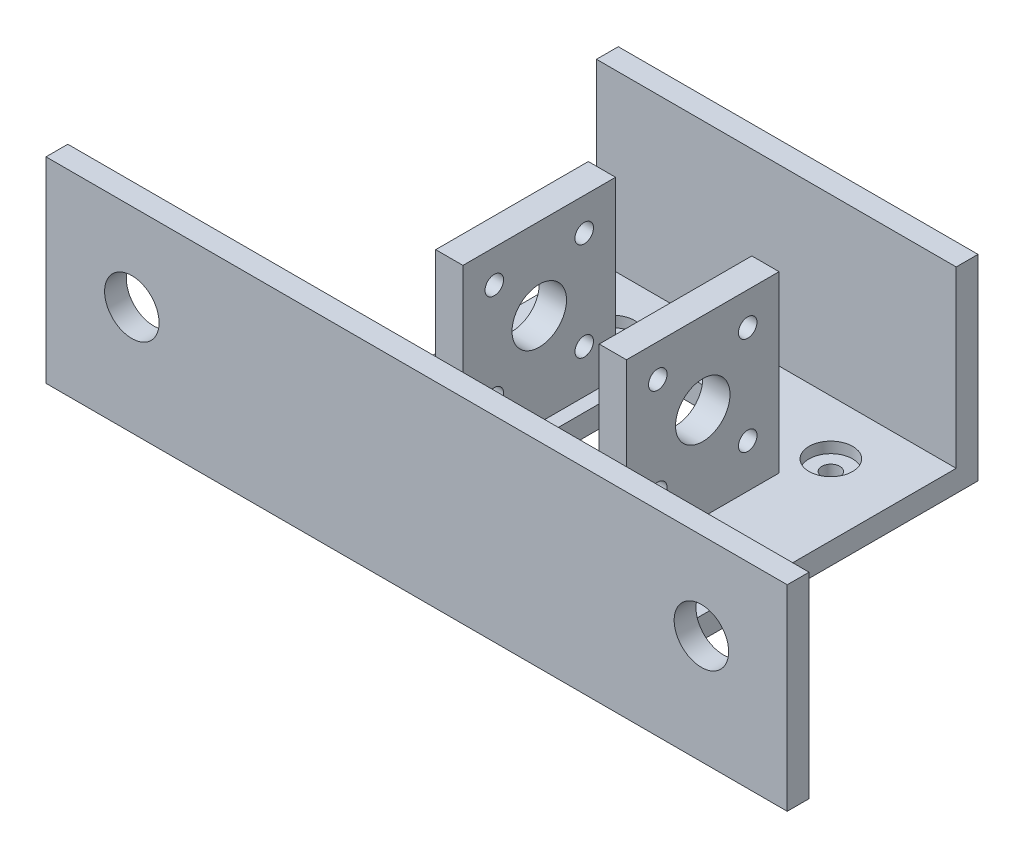
from build123d import *

# Parameters (mm, degrees)
SKETCH1_W                 = 75
SKETCH1_H                 = 40
SKETCH1_R                 = 5
SKETCH1_R_2               = 1.7
SKETCH1_W_2               = 10
SKETCH1_H_2               = 20
BOSS_EXTRUDE1_DEPTH       = 3
CUT_EXTRUDE1_DEPTH        = 43.605750786
CUT_EXTRUDE1_DEPTH_BACK   = 43.605750786
SKETCH2_W                 = 67
SKETCH2_H                 = 28
BOSS_EXTRUDE3_DEPTH       = 110
BOSS_EXTRUDE3_DEPTH_BACK  = 3
SKETCH3_W                 = 75
SKETCH3_H                 = 70
SKETCH3_W_2               = 67
SKETCH3_H_2               = 40
SKETCH6_W                 = 67
SKETCH6_H                 = 11
CUT_EXTRUDE4_DEPTH        = 122.372360939
SKETCH7_W                 = 70
SKETCH7_H                 = 37
BOSS_EXTRUDE4_DEPTH       = 45
SKETCH8_W                 = 45
SKETCH8_H                 = 62
CUT_EXTRUDE6_DEPTH        = 29
SKETCH11_W                = 45
SKETCH11_H                = 4
CUT_EXTRUDE9_DEPTH        = 157.445677473
SKETCH9_W                 = 38
SKETCH9_H                 = 28.5
CUT_EXTRUDE10_DEPTH       = 204.024629048
SKETCH13_W                = 5
SKETCH13_H                = 38
BOSS_EXTRUDE5_DEPTH       = 32
SKETCH14_R                = 5
SKETCH14_R_2              = 1.7
CUT_EXTRUDE11_DEPTH       = 32
SKETCH15_W                = 165
SKETCH15_H                = 70
SKETCH15_W_2              = 157
SKETCH15_H_2              = 62
BOSS_EXTRUDE6_DEPTH       = 3
SKETCH16_W                = 20
SKETCH16_H                = 4.820648258
CUT_EXTRUDE12_DEPTH       = 159.626132778
SKETCH18_R                = 5
CUT_EXTRUDE14_DEPTH       = 159.626132778
MIRROR6_COPY_1_SKETCH_W   = 5
MIRROR6_COPY_1_SKETCH_H   = 38
MIRROR6_COPY_1_DEPTH      = 32
MIRROR6_COPY_2_SKETCH_R   = 5
MIRROR6_COPY_2_SKETCH_R_2 = 1.7
MIRROR6_COPY_2_DEPTH      = 32
MIRROR6_COPY_3_SKETCH_W   = 5
MIRROR6_COPY_3_SKETCH_H   = 38
MIRROR6_COPY_3_DEPTH      = 32
MIRROR6_COPY_4_SKETCH_R   = 5
MIRROR6_COPY_4_SKETCH_R_2 = 1.7
MIRROR6_COPY_4_DEPTH      = 32
SKETCH19_W                = 38
SKETCH19_H                = 3.5
CUT_EXTRUDE15_DEPTH       = 10
SKETCH20_R                = 1.2
CUT_EXTRUDE16_DEPTH       = 10
SKETCH21_W                = 10
SKETCH21_H                = 80
CUT_EXTRUDE17_DEPTH       = 184.330984833
SKETCH22_W                = 55
SKETCH22_H                = 80
CUT_EXTRUDE18_DEPTH       = 184.330984833
SKETCH23_W                = 67
SKETCH23_H                = 62
BOSS_EXTRUDE7_DEPTH       = 4
SKETCH24_R                = 10
SKETCH24_R_2              = 1.65
CUT_EXTRUDE19_DEPTH       = 111.123793978
CUT_EXTRUDE21_START       = -16
SKETCH25_R                = 5
CUT_EXTRUDE21_DEPTH       = 16
SKETCH26_W                = 14.5
SKETCH26_H                = 36
CUT_EXTRUDE22_DEPTH       = 178.837706913
SKETCH27_W                = 5
SKETCH27_H                = 64
CUT_EXTRUDE23_DEPTH       = 43
CUT_EXTRUDE24_DEPTH       = 100.724620832
SKETCH29_R                = 4
SKETCH29_R_2              = 1.65
CUT_EXTRUDE25_DEPTH       = 2
SKETCH30_W                = 5
SKETCH30_H                = 28
BOSS_EXTRUDE8_DEPTH       = 32
CUT_EXTRUDE26_START       = -32
SKETCH32_R                = 5
SKETCH32_R_2              = 1.7
CUT_EXTRUDE26_DEPTH       = 32
CUT_EXTRUDE27_DEPTH       = 32


with BuildPart() as part:
    # Sketch1 → Boss-Extrude1 (new body)
    with BuildSketch(Plane(origin=(0, 0, 0), x_dir=(1, 0, 0), z_dir=(0, 1, 0))):
        Rectangle(SKETCH1_W, SKETCH1_H)
        with Locations((-21, 0)):
            Circle(SKETCH1_R, mode=Mode.SUBTRACT)
        with Locations((-30, 8.25)):
            Circle(SKETCH1_R_2, mode=Mode.SUBTRACT)
        with Locations((-12, 8.25)):
            Circle(SKETCH1_R_2, mode=Mode.SUBTRACT)
        with Locations((-12, -8.25)):
            Circle(SKETCH1_R_2, mode=Mode.SUBTRACT)
        with Locations((-30, -8.25)):
            Circle(SKETCH1_R_2, mode=Mode.SUBTRACT)
        with Locations((12, 8.25)):
            Circle(SKETCH1_R_2, mode=Mode.SUBTRACT)
        with Locations((12, -8.25)):
            Circle(SKETCH1_R_2, mode=Mode.SUBTRACT)
        with Locations((21, 0)):
            Circle(SKETCH1_R, mode=Mode.SUBTRACT)
        with Locations((30, -8.25)):
            Circle(SKETCH1_R_2, mode=Mode.SUBTRACT)
        with Locations((30, 8.25)):
            Circle(SKETCH1_R_2, mode=Mode.SUBTRACT)
        Rectangle(SKETCH1_W_2, SKETCH1_H_2, mode=Mode.SUBTRACT)
    extrude(amount=BOSS_EXTRUDE1_DEPTH)

    # Sketch2 → Cut-Extrude1 (cut, two sides: drawn at the far end of the back side and taken through both)
    with BuildSketch(Plane(origin=(0, 3, 0), x_dir=(1, 0, 0), z_dir=(0, 1, 0)).offset(-CUT_EXTRUDE1_DEPTH_BACK)):
        Rectangle(SKETCH2_W, SKETCH2_H)
    extrude(amount=CUT_EXTRUDE1_DEPTH + CUT_EXTRUDE1_DEPTH_BACK, mode=Mode.SUBTRACT)

    # Sketch3 → Boss-Extrude3 (add, two sides: drawn at the far end of the back side and taken through both)
    with BuildSketch(Plane(origin=(0, 3, 0), x_dir=(1, 0, 0), z_dir=(0, 1, 0)).offset(-BOSS_EXTRUDE3_DEPTH_BACK)):
        Rectangle(SKETCH3_W, SKETCH3_H)
        Rectangle(SKETCH3_W_2, SKETCH3_H_2, mode=Mode.SUBTRACT)
    extrude(amount=BOSS_EXTRUDE3_DEPTH + BOSS_EXTRUDE3_DEPTH_BACK)

    # Sketch6 → Cut-Extrude4 (cut, through all)
    with BuildSketch(Plane(origin=(0, 3, 0), x_dir=(1, 0, 0), z_dir=(0, 1, 0))):
        with Locations((0, -25.5)):
            Rectangle(SKETCH6_W, SKETCH6_H)
        with Locations((0, 25.5)):
            Rectangle(SKETCH6_W, SKETCH6_H)
    extrude(amount=CUT_EXTRUDE4_DEPTH, mode=Mode.SUBTRACT)

    # Sketch7 → Boss-Extrude4 (add)
    with BuildSketch(Plane.ZY.offset(37.5)):
        with Locations((0, 94.5)):
            Rectangle(SKETCH7_W, SKETCH7_H)
    boss_extrude4 = extrude(amount=BOSS_EXTRUDE4_DEPTH)

    # Mirror2: Boss-Extrude4 across plane
    add(boss_extrude4.mirror(Plane(origin=(0, 0, 0), x_dir=(0, 0, 1), z_dir=(1, 0, 0))))

    # Sketch8 → Cut-Extrude6 (cut)
    with BuildSketch(Plane(origin=(0, 113, 0), x_dir=(1, 0, 0), z_dir=(0, 1, 0))):
        with Locations((-56, 0)):
            Rectangle(SKETCH8_W, SKETCH8_H)
        with Locations((56, 0)):
            Rectangle(SKETCH8_W, SKETCH8_H)
    extrude(amount=-CUT_EXTRUDE6_DEPTH, mode=Mode.SUBTRACT)

    # Sketch11 → Cut-Extrude9 (cut, through all)
    with BuildSketch(Plane.XY.offset(35)):
        with Locations((-60, 78)):
            Rectangle(SKETCH11_W, SKETCH11_H)
        with Locations((60, 78)):
            Rectangle(SKETCH11_W, SKETCH11_H)
    extrude(amount=-CUT_EXTRUDE9_DEPTH, mode=Mode.SUBTRACT)

    # Sketch9 → Cut-Extrude10 (cut, through all)
    with BuildSketch(Plane.ZY.offset(82.5)):
        with Locations((0, 98.25)):
            Rectangle(SKETCH9_W, SKETCH9_H)
    extrude(amount=-CUT_EXTRUDE10_DEPTH, mode=Mode.SUBTRACT)

    # Sketch13 → Boss-Extrude5 (add)
    with BuildSketch(Plane(origin=(0, 84, 0), x_dir=(1, 0, 0), z_dir=(0, 1, 0))):
        with Locations((-39, 0)):
            Rectangle(SKETCH13_W, SKETCH13_H)
    boss_extrude5 = extrude(amount=BOSS_EXTRUDE5_DEPTH)

    # Sketch14 → Cut-Extrude11 (cut)
    with BuildSketch(Plane.ZY.offset(41.5)):
        with Locations((0, 101)):
            Circle(SKETCH14_R)
        with Locations((-8.25, 110)):
            Circle(SKETCH14_R_2)
        with Locations((8.25, 110)):
            Circle(SKETCH14_R_2)
        with Locations((8.25, 92)):
            Circle(SKETCH14_R_2)
        with Locations((-8.25, 92)):
            Circle(SKETCH14_R_2)
    cut_extrude11 = extrude(amount=-CUT_EXTRUDE11_DEPTH, mode=Mode.SUBTRACT)

    # Mirror4: Boss-Extrude5, Cut-Extrude11 across plane
    add(boss_extrude5.mirror(Plane(origin=(0, 0, 0), x_dir=(0, 0, 1), z_dir=(1, 0, 0))))
    add(cut_extrude11.mirror(Plane(origin=(0, 0, 0), x_dir=(0, 0, 1), z_dir=(1, 0, 0))), mode=Mode.SUBTRACT)

    # Sketch15 → Boss-Extrude6 (add)
    with BuildSketch(Plane(origin=(0, 113, 0), x_dir=(1, 0, 0), z_dir=(0, 1, 0))):
        Rectangle(SKETCH15_W, SKETCH15_H)
        Rectangle(SKETCH15_W_2, SKETCH15_H_2, mode=Mode.SUBTRACT)
    extrude(amount=BOSS_EXTRUDE6_DEPTH)

    # Sketch16 → Cut-Extrude12 (cut, through all)
    with BuildSketch(Plane.XY.offset(35)):
        with Locations((0, 11.636111214)):
            Rectangle(SKETCH16_W, SKETCH16_H)
    extrude(amount=-CUT_EXTRUDE12_DEPTH, mode=Mode.SUBTRACT)

    # Sketch18 → Cut-Extrude14 (cut, through all)
    with BuildSketch(Plane.XY.offset(35)):
        with Locations((52.25, 100)):
            Circle(SKETCH18_R)
    cut_extrude14 = extrude(amount=-CUT_EXTRUDE14_DEPTH, mode=Mode.SUBTRACT)

    # Mirror5: Cut-Extrude14 across plane
    add(cut_extrude14.mirror(Plane(origin=(0, 0, 0), x_dir=(0, 0, 1), z_dir=(1, 0, 0))), mode=Mode.SUBTRACT)

    # Mirror6 copy 1 sketch → Mirror6 copy 1 (add)
    with BuildSketch(Plane(origin=(0, 148, 0), x_dir=(-1, 0, 0), z_dir=(0, -1, 0))):
        with Locations((-39, 0)):
            Rectangle(MIRROR6_COPY_1_SKETCH_W, MIRROR6_COPY_1_SKETCH_H)
    extrude(amount=MIRROR6_COPY_1_DEPTH)

    # Mirror6 copy 2 sketch → Mirror6 copy 2 (cut)
    with BuildSketch(Plane(origin=(41.5, 232, 0), x_dir=(0, 0, 1), z_dir=(1, 0, 0))):
        with Locations((0, 101)):
            Circle(MIRROR6_COPY_2_SKETCH_R)
        with Locations((-8.25, 110)):
            Circle(MIRROR6_COPY_2_SKETCH_R_2)
        with Locations((8.25, 110)):
            Circle(MIRROR6_COPY_2_SKETCH_R_2)
        with Locations((8.25, 92)):
            Circle(MIRROR6_COPY_2_SKETCH_R_2)
        with Locations((-8.25, 92)):
            Circle(MIRROR6_COPY_2_SKETCH_R_2)
    extrude(amount=-MIRROR6_COPY_2_DEPTH, mode=Mode.SUBTRACT)

    # Mirror6 copy 3 sketch → Mirror6 copy 3 (add)
    with BuildSketch(Plane.XZ.offset(-148)):
        with Locations((-39, 0)):
            Rectangle(MIRROR6_COPY_3_SKETCH_W, MIRROR6_COPY_3_SKETCH_H)
    extrude(amount=MIRROR6_COPY_3_DEPTH)

    # Mirror6 copy 4 sketch → Mirror6 copy 4 (cut)
    with BuildSketch(Plane(origin=(-41.5, 232, 0), x_dir=(0, 0, 1), z_dir=(-1, 0, 0))):
        with Locations((0, -101)):
            Circle(MIRROR6_COPY_4_SKETCH_R)
        with Locations((-8.25, -110)):
            Circle(MIRROR6_COPY_4_SKETCH_R_2)
        with Locations((8.25, -110)):
            Circle(MIRROR6_COPY_4_SKETCH_R_2)
        with Locations((8.25, -92)):
            Circle(MIRROR6_COPY_4_SKETCH_R_2)
        with Locations((-8.25, -92)):
            Circle(MIRROR6_COPY_4_SKETCH_R_2)
    extrude(amount=-MIRROR6_COPY_4_DEPTH, mode=Mode.SUBTRACT)

    # Sketch19 → Cut-Extrude15 (cut)
    with BuildSketch(Plane(origin=(82.5, 0, 0), x_dir=(0, 0, -1), z_dir=(1, 0, 0))):
        with Locations((0, 114.25)):
            Rectangle(SKETCH19_W, SKETCH19_H)
    cut_extrude15 = extrude(amount=-CUT_EXTRUDE15_DEPTH, mode=Mode.SUBTRACT)

    # Mirror7: Cut-Extrude15 across plane
    add(cut_extrude15.mirror(Plane(origin=(0, 0, 0), x_dir=(0, 0, 1), z_dir=(1, 0, 0))), mode=Mode.SUBTRACT)

    # Sketch20 → Cut-Extrude16 (cut)
    with BuildSketch(Plane(origin=(0, 3, 0), x_dir=(1, 0, 0), z_dir=(0, 1, 0))):
        with Locations((-12, 17.5)):
            Circle(SKETCH20_R)
        with Locations((-12, -17.5)):
            Circle(SKETCH20_R)
        with Locations((-24, -17.5)):
            Circle(SKETCH20_R)
        with Locations((-24, 17.5)):
            Circle(SKETCH20_R)
        with Locations((12, -17.5)):
            Circle(SKETCH20_R)
        with Locations((24, -17.5)):
            Circle(SKETCH20_R)
        with Locations((12, 17.5)):
            Circle(SKETCH20_R)
        with Locations((24, 17.5)):
            Circle(SKETCH20_R)
    extrude(amount=-CUT_EXTRUDE16_DEPTH, mode=Mode.SUBTRACT)

    # Sketch21 → Cut-Extrude17 (cut, through all)
    with BuildSketch(Plane.XY.offset(35)):
        with Locations((32.5, 40)):
            Rectangle(SKETCH21_W, SKETCH21_H)
        with Locations((-32.5, 40)):
            Rectangle(SKETCH21_W, SKETCH21_H)
    extrude(amount=-CUT_EXTRUDE17_DEPTH, mode=Mode.SUBTRACT)

    # Sketch22 → Cut-Extrude18 (cut, through all)
    with BuildSketch(Plane.XY.offset(35)):
        with Locations((0, 40)):
            Rectangle(SKETCH22_W, SKETCH22_H)
    extrude(amount=-CUT_EXTRUDE18_DEPTH, mode=Mode.SUBTRACT)

    # Sketch23 → Boss-Extrude7 (add)
    with BuildSketch(Plane.XZ.offset(-80)):
        Rectangle(SKETCH23_W, SKETCH23_H)
    extrude(amount=-BOSS_EXTRUDE7_DEPTH)

    # Sketch24 → Cut-Extrude19 (cut, through all)
    with BuildSketch(Plane(origin=(0, 84, 0), x_dir=(1, 0, 0), z_dir=(0, 1, 0))):
        Circle(SKETCH24_R)
        with Locations((-20, 21)):
            Circle(SKETCH24_R_2)
        with Locations((-20, -21)):
            Circle(SKETCH24_R_2)
        with Locations((20, -21)):
            Circle(SKETCH24_R_2)
        with Locations((20, 21)):
            Circle(SKETCH24_R_2)
    extrude(amount=-CUT_EXTRUDE19_DEPTH, mode=Mode.SUBTRACT)

    # Sketch25 → Cut-Extrude21 (cut)
    with BuildSketch(Plane(origin=(0, 0, -35), x_dir=(-1, 0, 0), z_dir=(0, 0, -1)).offset(CUT_EXTRUDE21_START)):
        Polygon((33.5, 116), (33.5, 84), (33.5, 80), (82.5, 80), (82.5, 116), align=None)
        with Locations((52.25, 100)):
            Circle(SKETCH25_R, mode=Mode.SUBTRACT)
    cut_extrude21 = extrude(amount=CUT_EXTRUDE21_DEPTH, mode=Mode.SUBTRACT)

    # Mirror8: Cut-Extrude21 across plane
    add(cut_extrude21.mirror(Plane(origin=(0, 0, 0), x_dir=(0, 0, 1), z_dir=(1, 0, 0))), mode=Mode.SUBTRACT)

    # Sketch26 → Cut-Extrude22 (cut, through all)
    with BuildSketch(Plane(origin=(0, 0, -19), x_dir=(-1, 0, 0), z_dir=(0, 0, -1))):
        with Locations((75.25, 98)):
            Rectangle(SKETCH26_W, SKETCH26_H)
    cut_extrude22 = extrude(amount=-CUT_EXTRUDE22_DEPTH, mode=Mode.SUBTRACT)

    # Mirror9: Cut-Extrude22 across plane
    add(cut_extrude22.mirror(Plane(origin=(0, 0, 0), x_dir=(0, 0, 1), z_dir=(1, 0, 0))), mode=Mode.SUBTRACT)

    # Sketch27 → Cut-Extrude23 (cut)
    with BuildSketch(Plane(origin=(0, 0, -19), x_dir=(-1, 0, 0), z_dir=(0, 0, -1))):
        with Locations((-39, 116)):
            Rectangle(SKETCH27_W, SKETCH27_H)
    extrude(amount=-CUT_EXTRUDE23_DEPTH, mode=Mode.SUBTRACT)

    # Sketch28 → Cut-Extrude24 (cut, symmetric)
    with BuildSketch(Plane(origin=(0, 84, 0), x_dir=(1, 0, 0), z_dir=(0, 1, 0))):
        Polygon((68, 19), (33.5, 19), (33.5, 35), (33, 35), (33, 19), (33, -31), (68, -31), align=None)
    cut_extrude24 = extrude(amount=CUT_EXTRUDE24_DEPTH, both=True, mode=Mode.SUBTRACT)

    # Sketch29 → Cut-Extrude25 (cut)
    # profile 1 of 4: a face of its own
    with BuildSketch(Plane(origin=(0, 84, 0), x_dir=(1, 0, 0), z_dir=(0, 1, 0))):
        with Locations((-20, 21)):
            Circle(SKETCH29_R)
        with Locations((-20, 21)):
            Circle(SKETCH29_R_2, mode=Mode.SUBTRACT)
    # profile 2 of 4: a face of its own
    with BuildSketch(Plane(origin=(0, 84, 0), x_dir=(1, 0, 0), z_dir=(0, 1, 0))):
        with Locations((20, 21)):
            Circle(SKETCH29_R)
        with Locations((20, 21)):
            Circle(SKETCH29_R_2, mode=Mode.SUBTRACT)
    # profile 3 of 4: a face of its own
    with BuildSketch(Plane(origin=(0, 84, 0), x_dir=(1, 0, 0), z_dir=(0, 1, 0))):
        with Locations((20, -21)):
            Circle(SKETCH29_R)
        with Locations((20, -21)):
            Circle(SKETCH29_R_2, mode=Mode.SUBTRACT)
    # profile 4 of 4: a face of its own
    with BuildSketch(Plane(origin=(0, 84, 0), x_dir=(1, 0, 0), z_dir=(0, 1, 0))):
        with Locations((-20, -21)):
            Circle(SKETCH29_R)
        with Locations((-20, -21)):
            Circle(SKETCH29_R_2, mode=Mode.SUBTRACT)
    extrude(amount=-CUT_EXTRUDE25_DEPTH, mode=Mode.SUBTRACT)

    # Sketch30 → Boss-Extrude8 (add)
    with BuildSketch(Plane(origin=(0, 84, 0), x_dir=(1, 0, 0), z_dir=(0, 1, 0))):
        with Locations((15, 0)):
            Rectangle(SKETCH30_W, SKETCH30_H)
    boss_extrude8 = extrude(amount=BOSS_EXTRUDE8_DEPTH)

    # Sketch32 → Cut-Extrude26 (cut)
    with BuildSketch(Plane(origin=(17.5, 0, 0), x_dir=(0, 0, -1), z_dir=(1, 0, 0)).offset(CUT_EXTRUDE26_START)):
        with Locations((0, 101)):
            Circle(SKETCH32_R)
        with Locations((8.25, 110)):
            Circle(SKETCH32_R_2)
        with Locations((-8.25, 110)):
            Circle(SKETCH32_R_2)
        with Locations((-8.25, 92)):
            Circle(SKETCH32_R_2)
        with Locations((8.25, 92)):
            Circle(SKETCH32_R_2)
    cut_extrude26 = extrude(amount=CUT_EXTRUDE26_DEPTH, mode=Mode.SUBTRACT)

    # Mirror11: Cut-Extrude24 across plane
    add(cut_extrude24.mirror(Plane(origin=(0, 0, 0), x_dir=(0, 0, 1), z_dir=(1, 0, 0))), mode=Mode.SUBTRACT)

    # Mirror16: Boss-Extrude8 across plane
    add(boss_extrude8.mirror(Plane(origin=(0, 0, 0), x_dir=(0, 0, 1), z_dir=(1, 0, 0))))

    # Mirror18: Cut-Extrude26 across plane
    add(cut_extrude26.mirror(Plane(origin=(0, 0, 0), x_dir=(0, 0, 1), z_dir=(1, 0, 0))), mode=Mode.SUBTRACT)

    # Sketch34 → Cut-Extrude27 (cut)
    with BuildSketch(Plane(origin=(0, 84, 0), x_dir=(1, 0, 0), z_dir=(0, 1, 0))):
        with BuildLine():
            ThreePointArc((10, 0), (0, -10), (-10, 0))
            Line((-10, 0), (-10, -21))
            Line((-10, -21), (10, -21))
            Line((10, -21), (10, 0))
        make_face()
        with BuildLine():
            Line((-10, 21), (-10, 0))
            ThreePointArc((-10, 0), (0, 10), (10, 0))
            Line((10, 0), (10, 21))
            Line((10, 21), (-10, 21))
        make_face()
    extrude(amount=-CUT_EXTRUDE27_DEPTH, mode=Mode.SUBTRACT)


solid = part.part
